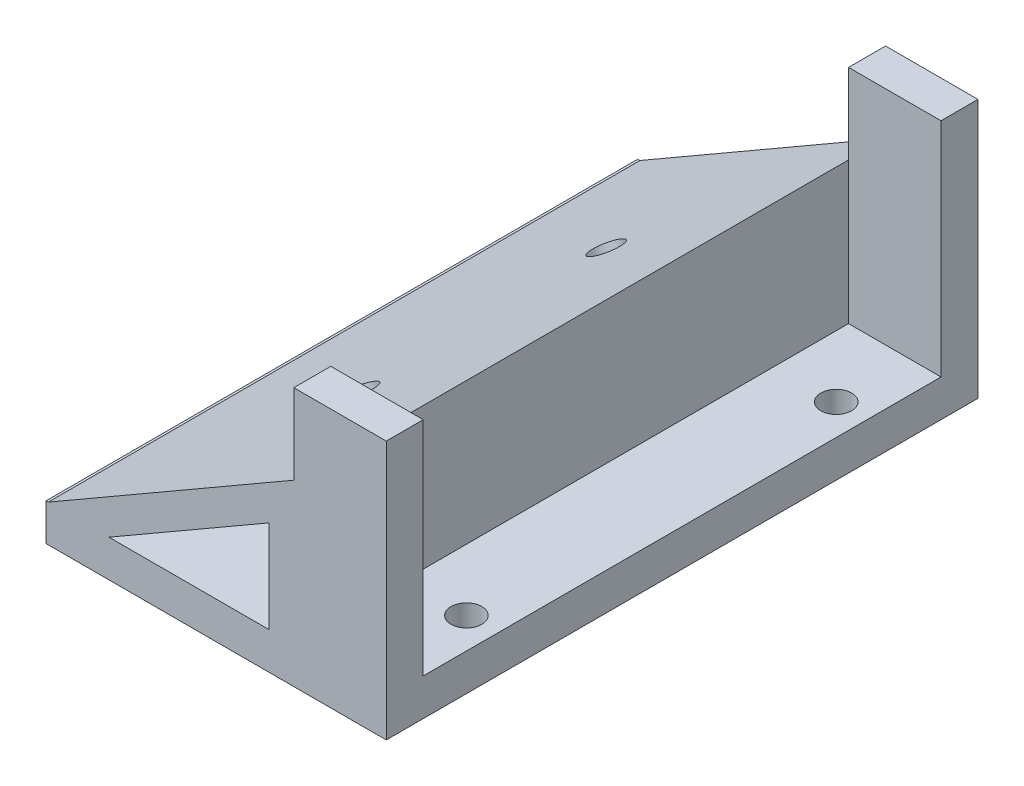
from build123d import *

# Parameters (mm, degrees)
SKETCH1_W           = 27.6
SKETCH1_H           = 48
BOSS_EXTRUDE1_DEPTH = 3
SKETCH2_R           = 1.5
SKETCH2_R_2         = 1.25
CUT_EXTRUDE1_DEPTH  = 123.022371745
BOSS_EXTRUDE2_DEPTH = 48
CUT_EXTRUDE5_DEPTH  = 110.836772471
SKETCH8_R           = 2.5
CUT_EXTRUDE6_DEPTH  = 1
CUT_EXTRUDE7_REACH  = 113.8
SKETCH9_R           = 1.25
SKETCH10_R          = 2.5
CUT_EXTRUDE8_DEPTH  = 0.5
SKETCH11_W          = 7.5
SKETCH11_H          = 3
BOSS_EXTRUDE3_DEPTH = 18


with BuildPart() as part:
    # Sketch1 → Boss-Extrude1 (new body)
    with BuildSketch(Plane(origin=(0, 0, 0), x_dir=(1, 0, 0), z_dir=(0, 1, 0))):
        with Locations((-83.923418825, 49.010907537)):
            Rectangle(SKETCH1_W, SKETCH1_H)
    extrude(amount=BOSS_EXTRUDE1_DEPTH)

    # Sketch2 → Cut-Extrude1 (cut, through all)
    with BuildSketch(Plane(origin=(0, 3, 0), x_dir=(1, 0, 0), z_dir=(0, 1, 0))):
        with Locations((-82.623418825, 65.263988229)):
            Circle(SKETCH2_R)
        with Locations((-82.623418825, 32.763988229)):
            Circle(SKETCH2_R)
        with Locations((-72.623418825, 34.010907537)):
            Circle(SKETCH2_R_2)
        with Locations((-72.623418825, 64.010907537)):
            Circle(SKETCH2_R_2)
    extrude(amount=-CUT_EXTRUDE1_DEPTH, mode=Mode.SUBTRACT)

    # Sketch4 → Boss-Extrude2 (add)
    with BuildSketch(Plane.XY.offset(-25.010907537)):
        Polygon((-77.623418825, 3), (-97.542003112, 3), (-77.623418825, 14.5), align=None)
    extrude(amount=-BOSS_EXTRUDE2_DEPTH)

    # Sketch6 → Cut-Extrude5 (cut, through all)
    with BuildSketch(Plane.XY.offset(-25.010907537)):
        Polygon((-92.613799881, 3), (-79.623418825, 3), (-79.623418825, 10.5), align=None)
    extrude(amount=-CUT_EXTRUDE5_DEPTH, mode=Mode.SUBTRACT)

    # Sketch8 → Cut-Extrude6 (cut)
    with BuildSketch(Plane(origin=(0, 3, 0), x_dir=(1, 0, 0), z_dir=(0, 1, 0))):
        with Locations((-82.623418825, 32.763988229)):
            Circle(SKETCH8_R)
        with Locations((-82.623418825, 65.263988229)):
            Circle(SKETCH8_R)
    extrude(amount=-CUT_EXTRUDE6_DEPTH, mode=Mode.SUBTRACT)

    # Sketch9 → Cut-Extrude7 (cut, up to next)
    with BuildSketch(Plane(origin=(-25.684538884, 44.486926315, 0), x_dir=(0.8660254037844415, 0.49999999999999506, 0), z_dir=(-0.49999999999999506, 0.8660254037844415, 0)), mode=Mode.PRIVATE) as cut_extrude7_sk1:
        with Locations((-69.973852631, 59.010907537)):
            Circle(SKETCH9_R)
    cut_extrude7_tool1 = extrude(cut_extrude7_sk1.sketch, amount=-CUT_EXTRUDE7_REACH, mode=Mode.PRIVATE) & part.part
    # Sketch9 → Cut-Extrude7 (cut, up to next)
    with BuildSketch(Plane(origin=(-25.684538884, 44.486926315, 0), x_dir=(0.8660254037844415, 0.49999999999999506, 0), z_dir=(-0.49999999999999506, 0.8660254037844415, 0)), mode=Mode.PRIVATE) as cut_extrude7_sk2:
        with Locations((-69.973852631, 39.010907537)):
            Circle(SKETCH9_R)
    cut_extrude7_tool2 = extrude(cut_extrude7_sk2.sketch, amount=-CUT_EXTRUDE7_REACH, mode=Mode.PRIVATE) & part.part
    add(cut_extrude7_tool1.solids().sort_by_distance((-86.283673, 9.5, -59.010908))[0], mode=Mode.SUBTRACT)
    add(cut_extrude7_tool2.solids().sort_by_distance((-86.283673, 9.5, -39.010908))[0], mode=Mode.SUBTRACT)

    # Sketch10 → Cut-Extrude8 (cut)
    with BuildSketch(Plane(origin=(-24.452488076, 42.352951719, 0), x_dir=(-0.8660254037844358, -0.5000000000000049, 0), z_dir=(0.5000000000000049, -0.8660254037844358, 0))):
        with Locations((69.973852631, 59.010907537)):
            Circle(SKETCH10_R)
        with Locations((69.973852631, 39.010907537)):
            Circle(SKETCH10_R)
    extrude(amount=-CUT_EXTRUDE8_DEPTH, mode=Mode.SUBTRACT)

    # Sketch11 → Boss-Extrude3 (add)
    with BuildSketch(Plane(origin=(0, 3, 0), x_dir=(1, 0, 0), z_dir=(0, 1, 0))):
        with Locations((-73.873418825, 26.510907537)):
            Rectangle(SKETCH11_W, SKETCH11_H)
        with Locations((-73.873418825, 71.510907537)):
            Rectangle(SKETCH11_W, SKETCH11_H)
    extrude(amount=BOSS_EXTRUDE3_DEPTH)


solid = part.part
